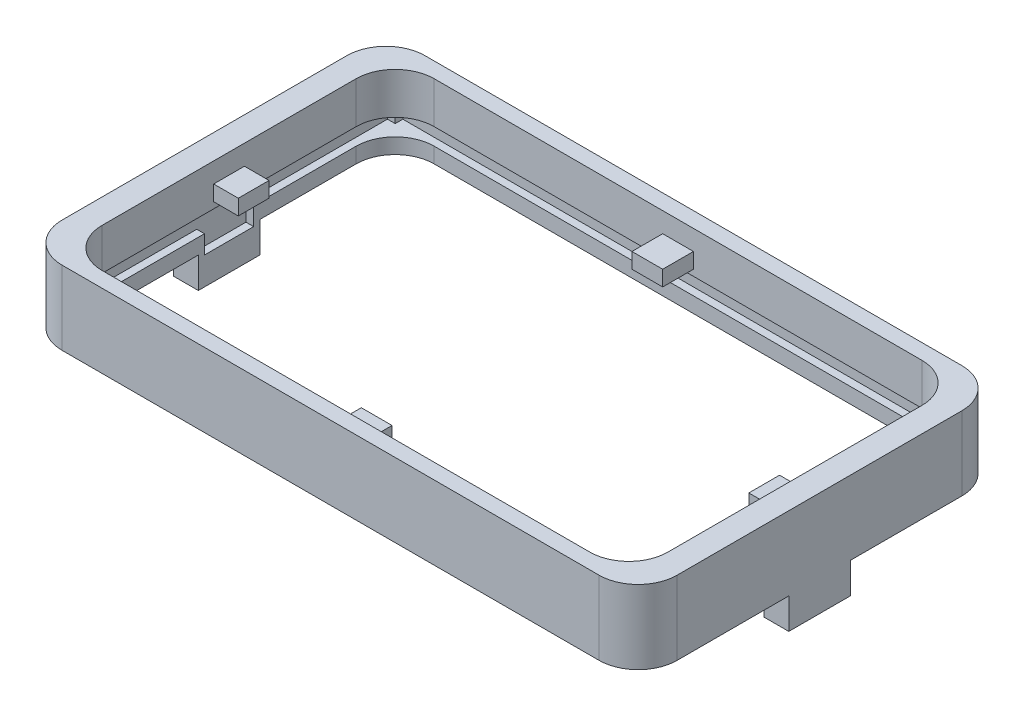
from build123d import *

# Parameters (mm, degrees)
SKETCH1_W                      = 100
SKETCH1_H                      = 59
BOSS_EXTRUDE1_DEPTH            = 12
SKETCH2_W                      = 92
SKETCH2_H                      = 54
CUT_EXTRUDE1_DEPTH             = 60.281109976
SKETCH3_W                      = 54
SKETCH3_H                      = 2.75
CUT_EXTRUDE2_DEPTH             = 1.25
SKETCH4_W                      = 54
SKETCH4_H                      = 2.75
CUT_EXTRUDE3_DEPTH             = 1.25
SKETCH5_W                      = 92
SKETCH5_H                      = 2.75
CUT_EXTRUDE4_DEPTH             = 1.25
SKETCH6_W                      = 92
SKETCH6_H                      = 2.75
CUT_EXTRUDE5_DEPTH             = 1.25
FILLET1_R                      = 1
SKETCH7_W                      = 4
SKETCH7_H                      = 10
BOSS_EXTRUDE2_DEPTH            = 5
CUT_EXTRUDE6_REACH             = 103.145
SKETCH8_W                      = 8
SKETCH8_H                      = 3
CUT_EXTRUDE6_DIRECTION_2_REACH = 103.145
FILLET2_R                      = 6.35
SKETCH9_W                      = 5
SKETCH9_H                      = 2.5
BOSS_EXTRUDE3_DEPTH            = 5
SKETCH10_W                     = 5
SKETCH10_H                     = 2.5
BOSS_EXTRUDE4_DEPTH            = 5
SKETCH11_W                     = 5
SKETCH11_H                     = 2.5
BOSS_EXTRUDE5_DEPTH            = 5
SKETCH12_W                     = 5
SKETCH12_H                     = 2.5
BOSS_EXTRUDE6_DEPTH            = 4


with BuildPart() as part:
    # Sketch1 → Boss-Extrude1 (new body)
    with BuildSketch(Plane(origin=(0, 0, 0), x_dir=(1, 0, 0), z_dir=(0, 1, 0))):
        Rectangle(SKETCH1_W, SKETCH1_H)
    extrude(amount=BOSS_EXTRUDE1_DEPTH)

    # Sketch2 → Cut-Extrude1 (cut, through all)
    with BuildSketch(Plane(origin=(0, 12, 0), x_dir=(1, 0, 0), z_dir=(0, 1, 0))):
        Rectangle(SKETCH2_W, SKETCH2_H)
    extrude(amount=-CUT_EXTRUDE1_DEPTH, mode=Mode.SUBTRACT)

    # Sketch3 → Cut-Extrude2 (cut)
    with BuildSketch(Plane(origin=(-46, 0, 0), x_dir=(0, 0, -1), z_dir=(1, 0, 0))):
        with Locations((0, 3.875)):
            Rectangle(SKETCH3_W, SKETCH3_H)
    extrude(amount=-CUT_EXTRUDE2_DEPTH, mode=Mode.SUBTRACT)

    # Sketch4 → Cut-Extrude3 (cut)
    with BuildSketch(Plane.ZY.offset(-46)):
        with Locations((0, 3.875)):
            Rectangle(SKETCH4_W, SKETCH4_H)
    extrude(amount=-CUT_EXTRUDE3_DEPTH, mode=Mode.SUBTRACT)

    # Sketch5 → Cut-Extrude4 (cut)
    with BuildSketch(Plane.XY.offset(-27)):
        with Locations((0, 3.875)):
            Rectangle(SKETCH5_W, SKETCH5_H)
    extrude(amount=-CUT_EXTRUDE4_DEPTH, mode=Mode.SUBTRACT)

    # Sketch6 → Cut-Extrude5 (cut)
    with BuildSketch(Plane(origin=(0, 0, 27), x_dir=(-1, 0, 0), z_dir=(0, 0, -1))):
        with Locations((0, 3.875)):
            Rectangle(SKETCH6_W, SKETCH6_H)
    extrude(amount=-CUT_EXTRUDE5_DEPTH, mode=Mode.SUBTRACT)

    # Fillet1
    fillet1_edges = [part.edges().sort_by_distance(p)[0] for p in [
        (0, 5.25, -28.25),
        (0, 5.25, 28.25),
    ]]
    fillet(fillet1_edges, radius=FILLET1_R)

    # Sketch7 → Boss-Extrude2 (add)
    with BuildSketch(Plane.XZ):
        with Locations((-48, 0)):
            Rectangle(SKETCH7_W, SKETCH7_H)
    boss_extrude2 = extrude(amount=BOSS_EXTRUDE2_DEPTH)

    # Mirror2: Boss-Extrude2 across plane
    add(boss_extrude2.mirror(Plane(origin=(0, 0, 0), x_dir=(0, 0, 1), z_dir=(1, 0, 0))))

    # Cut-Extrude6: up to this face of the body (flat: up to its plane)
    cut_extrude6_end = Plane(part.part.faces().sort_by_distance((-47.25, 3.875, 0))[0])
    # Sketch8 → Cut-Extrude6 (cut, up to the picked face)
    with BuildSketch(Plane(origin=(-46, 0, 0), x_dir=(0, 0, -1), z_dir=(1, 0, 0)), mode=Mode.PRIVATE) as cut_extrude6_sk1:
        with Locations((0, 1)):
            Rectangle(SKETCH8_W, SKETCH8_H)
    cut_extrude6_tool1 = split(extrude(cut_extrude6_sk1.sketch, amount=-CUT_EXTRUDE6_REACH, mode=Mode.PRIVATE), bisect_by=cut_extrude6_end, keep=Keep.BOTH, mode=Mode.PRIVATE)
    add(cut_extrude6_tool1.solids().sort_by(Axis((-46, 1, 0), (-1, 0, 0)))[0], mode=Mode.SUBTRACT)

    # Cut-Extrude6 direction 2: up to this face of the body (flat: up to its plane)
    cut_extrude6_direction_2_end = Plane(part.part.faces().sort_by_distance((47.25, 3.875, 0))[0])
    # Sketch8 → Cut-Extrude6 direction 2 (cut, up to the picked face)
    with BuildSketch(Plane(origin=(-46, 0, 0), x_dir=(0, 0, -1), z_dir=(1, 0, 0)), mode=Mode.PRIVATE) as cut_extrude6_direction_2_sk1:
        with Locations((0, 1)):
            Rectangle(SKETCH8_W, SKETCH8_H)
    cut_extrude6_direction_2_tool1 = split(extrude(cut_extrude6_direction_2_sk1.sketch, amount=CUT_EXTRUDE6_DIRECTION_2_REACH, mode=Mode.PRIVATE), bisect_by=cut_extrude6_direction_2_end, keep=Keep.BOTH, mode=Mode.PRIVATE)
    add(cut_extrude6_direction_2_tool1.solids().sort_by(Axis((-46, 1, 0), (1, 0, 0)))[0], mode=Mode.SUBTRACT)

    # Fillet2
    # the kernel refuses this fillet: 6.35 mm, written as the material it adds along each edge
    with BuildSketch(Plane(origin=(-46, 18.375, -27), x_dir=(1, 0, 0), z_dir=(0, -1, 0))) as fillet2_piece_1_section:
        with BuildLine():
            CenterArc((FILLET2_R, FILLET2_R), FILLET2_R, 180, 90)
            Line((0, FILLET2_R), (0, 0))
            Line((0, 0), (FILLET2_R, 0))
        make_face()
    fillet2_piece_1 = extrude(amount=18.375, mode=Mode.PRIVATE)
    fillet2_piece_1 = split(fillet2_piece_1, bisect_by=Plane(origin=(-44.562391024, 5.25, -25.562391024), z_dir=(0, 1, 0)), keep=Keep.TOP, mode=Mode.PRIVATE)
    fillet2_piece_1 = split(fillet2_piece_1, bisect_by=Plane(origin=(-44.562391024, 12, -25.562391024), z_dir=(0, -1, 0)), keep=Keep.TOP, mode=Mode.PRIVATE)
    add(fillet2_piece_1)
    with BuildSketch(Plane(origin=(-46, 2.5, -27), x_dir=(1, 0, 0), z_dir=(0, -1, 0)), Plane(origin=(-46, 2.5, 27), x_dir=(0, 0, -1), z_dir=(0, -1, 0))) as fillet2_piece_2:
        with BuildLine():
            CenterArc((FILLET2_R, FILLET2_R), FILLET2_R, 180, 90)
            Line((0, FILLET2_R), (0, 0))
            Line((0, 0), (FILLET2_R, 0))
        make_face()
    extrude(amount=2.5)
    with BuildSketch(Plane(origin=(46, 18.375, -27), x_dir=(-1, 0, 0), z_dir=(0, -1, 0))) as fillet2_piece_3_section:
        with BuildLine():
            CenterArc((FILLET2_R, -FILLET2_R), FILLET2_R, 90, 90)
            Line((0, -FILLET2_R), (0, 0))
            Line((0, 0), (FILLET2_R, 0))
        make_face()
    fillet2_piece_3 = extrude(amount=18.375, mode=Mode.PRIVATE)
    fillet2_piece_3 = split(fillet2_piece_3, bisect_by=Plane(origin=(44.562391024, 5.25, -25.562391024), z_dir=(0, 1, 0)), keep=Keep.TOP, mode=Mode.PRIVATE)
    fillet2_piece_3 = split(fillet2_piece_3, bisect_by=Plane(origin=(44.562391024, 12, -25.562391024), z_dir=(0, -1, 0)), keep=Keep.TOP, mode=Mode.PRIVATE)
    add(fillet2_piece_3)
    with BuildSketch(Plane(origin=(46, 2.5, -27), x_dir=(-1, 0, 0), z_dir=(0, -1, 0)), Plane(origin=(46, 2.5, 27), x_dir=(0, 0, -1), z_dir=(0, -1, 0))) as fillet2_piece_4:
        with BuildLine():
            CenterArc((FILLET2_R, -FILLET2_R), FILLET2_R, 90, 90)
            Line((0, -FILLET2_R), (0, 0))
            Line((0, 0), (FILLET2_R, 0))
        make_face()
    extrude(amount=2.5)
    with BuildSketch(Plane(origin=(-46, 18.375, 27), x_dir=(0, 0, -1), z_dir=(0, -1, 0))) as fillet2_piece_5_section:
        with BuildLine():
            CenterArc((FILLET2_R, FILLET2_R), FILLET2_R, 180, 90)
            Line((0, FILLET2_R), (0, 0))
            Line((0, 0), (FILLET2_R, 0))
        make_face()
    fillet2_piece_5 = extrude(amount=18.375, mode=Mode.PRIVATE)
    fillet2_piece_5 = split(fillet2_piece_5, bisect_by=Plane(origin=(-44.562391024, 12, 25.562391024), z_dir=(0, -1, 0)), keep=Keep.TOP, mode=Mode.PRIVATE)
    fillet2_piece_5 = split(fillet2_piece_5, bisect_by=Plane(origin=(-44.562391024, 5.25, 25.562391024), z_dir=(0, 1, 0)), keep=Keep.TOP, mode=Mode.PRIVATE)
    add(fillet2_piece_5)
    with BuildSketch(Plane(origin=(46, 18.375, 27), x_dir=(0, 0, -1), z_dir=(0, -1, 0))) as fillet2_piece_6_section:
        with BuildLine():
            CenterArc((FILLET2_R, -FILLET2_R), FILLET2_R, 90, 90)
            Line((0, -FILLET2_R), (0, 0))
            Line((0, 0), (FILLET2_R, 0))
        make_face()
    fillet2_piece_6 = extrude(amount=18.375, mode=Mode.PRIVATE)
    fillet2_piece_6 = split(fillet2_piece_6, bisect_by=Plane(origin=(44.562391024, 12, 25.562391024), z_dir=(0, -1, 0)), keep=Keep.TOP, mode=Mode.PRIVATE)
    fillet2_piece_6 = split(fillet2_piece_6, bisect_by=Plane(origin=(44.562391024, 5.25, 25.562391024), z_dir=(0, 1, 0)), keep=Keep.TOP, mode=Mode.PRIVATE)
    add(fillet2_piece_6)
    # the kernel refuses this fillet: 6.35 mm, written as the material it takes off along each edge
    with BuildSketch(Plane(origin=(-50, -15.875, -29.5), x_dir=(1, 0, 0), z_dir=(0, 1, 0)), Plane(origin=(-50, -15.875, 29.5), x_dir=(0, 0, -1), z_dir=(0, 1, 0))) as fillet2_2_piece_1:
        with BuildLine():
            CenterArc((FILLET2_R, -FILLET2_R), FILLET2_R, 90, 90)
            Line((0, -FILLET2_R), (0, 0))
            Line((0, 0), (FILLET2_R, 0))
        make_face()
    extrude(amount=43.75, mode=Mode.SUBTRACT)
    with BuildSketch(Plane(origin=(50, -15.875, 29.5), x_dir=(0, 0, -1), z_dir=(0, 1, 0)), Plane(origin=(50, -15.875, -29.5), x_dir=(-1, 0, 0), z_dir=(0, 1, 0))) as fillet2_2_piece_2:
        with BuildLine():
            CenterArc((FILLET2_R, FILLET2_R), FILLET2_R, 180, 90)
            Line((0, FILLET2_R), (0, 0))
            Line((0, 0), (FILLET2_R, 0))
        make_face()
    extrude(amount=43.75, mode=Mode.SUBTRACT)

    # Sketch9 → Boss-Extrude3 (add)
    with BuildSketch(Plane(origin=(0, 0, 27), x_dir=(-1, 0, 0), z_dir=(0, 0, -1))):
        with Locations((0, 7.5)):
            Rectangle(SKETCH9_W, SKETCH9_H)
    extrude(amount=BOSS_EXTRUDE3_DEPTH)

    # Sketch10 → Boss-Extrude4 (add)
    with BuildSketch(Plane.XY.offset(-27)):
        with Locations((0, 7.5)):
            Rectangle(SKETCH10_W, SKETCH10_H)
    extrude(amount=BOSS_EXTRUDE4_DEPTH)

    # Sketch11 → Boss-Extrude5 (add)
    with BuildSketch(Plane.ZY.offset(-46)):
        with Locations((0, 7.5)):
            Rectangle(SKETCH11_W, SKETCH11_H)
    extrude(amount=BOSS_EXTRUDE5_DEPTH)

    # Sketch12 → Boss-Extrude6 (add)
    with BuildSketch(Plane(origin=(-46, 0, 0), x_dir=(0, 0, -1), z_dir=(1, 0, 0))):
        with Locations((0, 7.5)):
            Rectangle(SKETCH12_W, SKETCH12_H)
    extrude(amount=BOSS_EXTRUDE6_DEPTH)


solid = part.part
